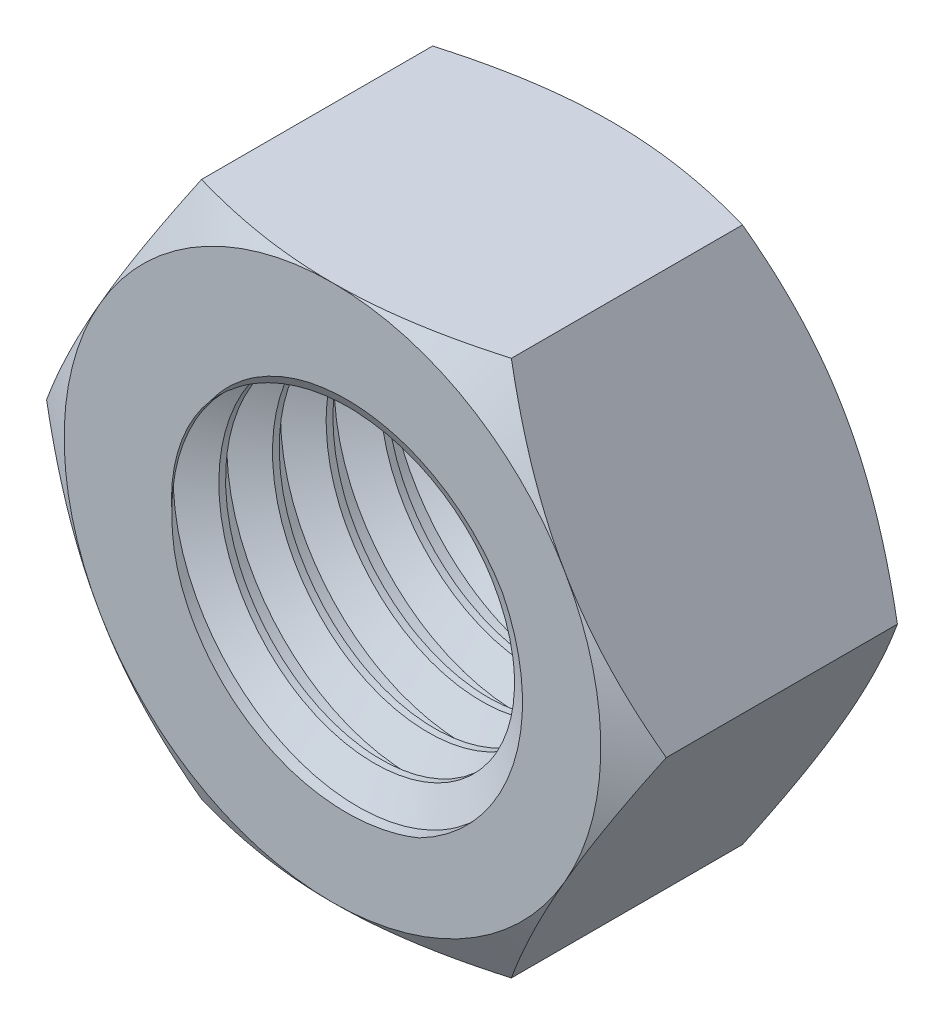
from build123d import *

# Parameters (mm, degrees)
EXTRUDE_1_DEPTH     = 5.200000014
SKETCH_6_R          = 3.000000026
CUT_EXTRUDE_1_DEPTH = 10.239768984
SWEEP_1_PITCH       = 1.000000047


with BuildPart() as part:
    # 草图1 → 拉伸1 (new body)
    with BuildSketch(Plane.XY):
        Polygon((5.773502563, 0), (2.886751281, 4.999999888), (-2.886751281, 4.999999888), (-5.773502563, 0), (-2.886751281, -4.999999888), (2.886751281, -4.999999888), align=None)
    extrude(amount=EXTRUDE_1_DEPTH)

    # 草图3 → 切除-旋转1 (revolve, cut)
    with BuildSketch(Plane(origin=(0, 0, 0), x_dir=(1, 0, 0), z_dir=(0, 1, 0))):
        Polygon((4.999999888, 0), (5.773502563, -0.446581977), (5.773502563, 0), align=None)
    revolve(axis=Axis((0, 0, -4.958997126), (0, 0, 1)), mode=Mode.SUBTRACT)

    # 草图5 → 切除-旋转2 (revolve, cut)
    with BuildSketch(Plane(origin=(0, 0, 0), x_dir=(1, 0, 0), z_dir=(0, 1, 0))):
        Polygon((4.999999888, -5.200000014), (5.773502563, -4.753418037), (5.773502563, -5.200000014), align=None)
    revolve(axis=Axis((0, 0, -5.594352164), (0, 0, 1)), mode=Mode.SUBTRACT)

    # 草图6 → 切除-拉伸1 (cut, through all)
    with BuildSketch(Plane.XY.offset(5.200000014)):
        Circle(SKETCH_6_R)
    extrude(amount=-CUT_EXTRUDE_1_DEPTH, mode=Mode.SUBTRACT)

    # 切除-扫描1: arcs per turn and ends read off the stored shape
    # 切除-扫描1: the profile of 草图7 profile screwed along a right-hand helix through 7 turns, 6 arcs to a turn; built about Z, then put on its axis
    sweep_1_z = Axis((0, 0, 0), (0, 0, 1))
    sweep_1_corners = [(3.541265917, 0, -0.875000042), (2.999700026, 0, -0.562326829), (2.999700026, 0, -1.437673266), (3.541265917, 0, -1.125000053)]
    with BuildLine(mode=Mode.PRIVATE) as sweep_1_profile:
        Line(sweep_1_corners[0], sweep_1_corners[1])
        Line(sweep_1_corners[1], sweep_1_corners[2])
        Line(sweep_1_corners[2], sweep_1_corners[3])
        Line(sweep_1_corners[3], sweep_1_corners[0])
    sweep_1_cap = Face(sweep_1_profile.wire())
    sweep_1_turn_angles = [0, 30, 60, 90, 120, 150, 180, 210, 240, 270, 300, 330, 360]
    sweep_1_turn_weights = [1, 0.8660254037844387, 1, 0.8660254037844387, 1, 0.8660254037844387, 1, 0.8660254037844387, 1, 0.8660254037844387, 1, 0.8660254037844387, 1]
    sweep_1_turn_rails = [Edge.make_bspline([Vector(p[0], p[1], 0).rotate(sweep_1_z, sweep_1_turn_angles[k]) / sweep_1_turn_weights[k] + Vector(0, 0, p[2] + SWEEP_1_PITCH * sweep_1_turn_angles[k] / 360) for k in range(13)], [0, 0, 0, 1, 1, 2, 2, 3, 3, 4, 4, 5, 5, 6, 6, 6], 2, sweep_1_turn_weights) for p in sweep_1_corners]
    sweep_1_turn_sides = [Face.make_surface_from_curves(sweep_1_turn_rails[p[0]], sweep_1_turn_rails[p[1]]) for p in [(0, 1), (1, 2), (2, 3), (3, 0)]]
    sweep_1 = Plane(origin=(0, 0, 0), x_dir=(0, -1, 0), z_dir=(0, 0, 1)) * Solid(Shell([*[p.moved(Location((0, 0, SWEEP_1_PITCH * i))) for i in range(7) for p in sweep_1_turn_sides], sweep_1_cap, sweep_1_cap.rotate(sweep_1_z, 2520).moved(Location((0, 0, SWEEP_1_PITCH * 2520 / 360)))]))
    add(sweep_1, mode=Mode.SUBTRACT)


solid = part.part
